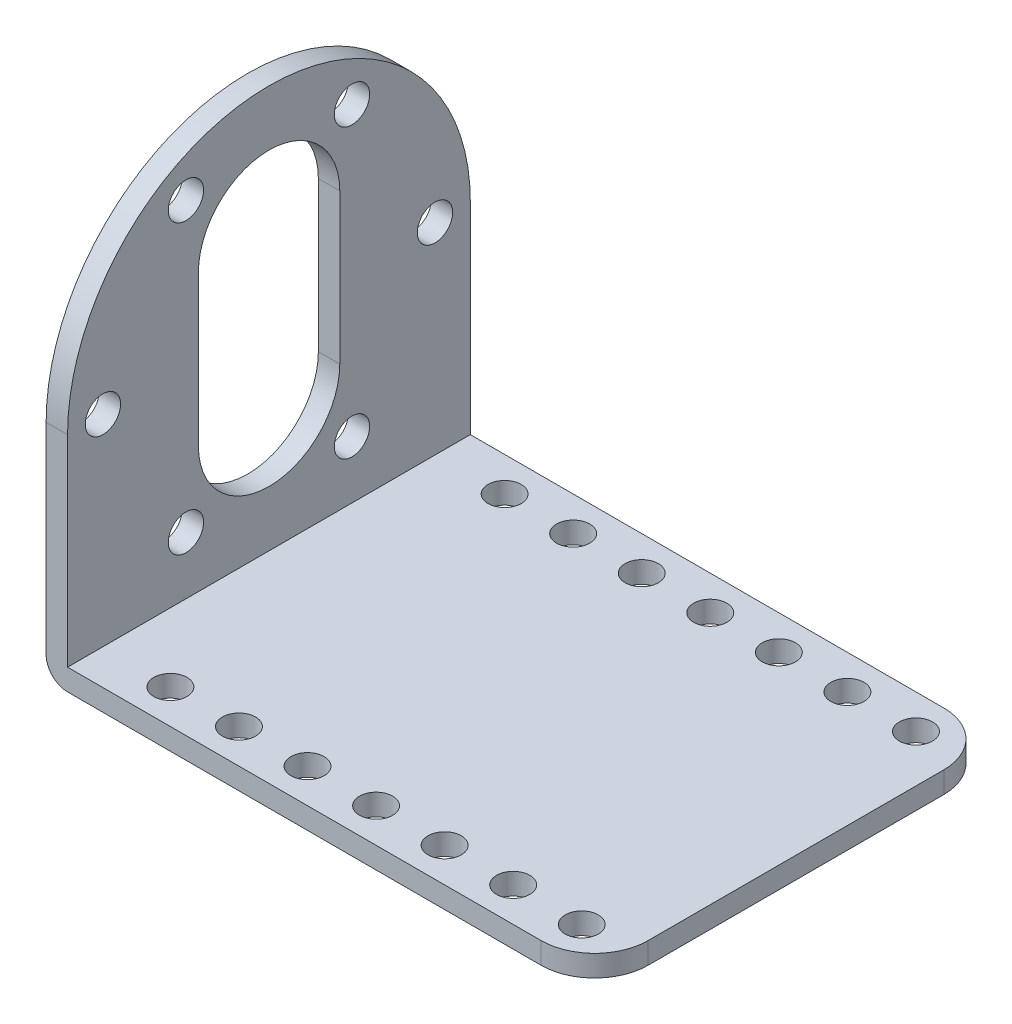
from build123d import *

# Parameters (mm, degrees)
SKETCH1_W           = 49.2
SKETCH1_H           = 37.6
BOSS_EXTRUDE1_DEPTH = 2
SKETCH2_W           = 2
SKETCH2_H           = 37.6
BOSS_EXTRUDE2_DEPTH = 37.6
BOSS_EXTRUDE5_DEPTH = 37.6
CUT_EXTRUDE1_REACH  = 78.051
SKETCH4_R           = 1.55
FILLET2_R           = 5
CUT_EXTRUDE2_REACH  = 70.887
SKETCH5_R           = 1.65
CUT_EXTRUDE3_START  = -2
CUT_EXTRUDE3_DEPTH  = 2
CUT_EXTRUDE4_REACH  = 70.887


# Read off the part's stored shape, not the designer's step: Cut-Extrude3
with BuildPart() as part:
    # Sketch1 → Boss-Extrude1 (new body)
    with BuildSketch(Plane(origin=(0, 0, 0), x_dir=(1, 0, 0), z_dir=(0, 1, 0))):
        with Locations((-33.511891694, -8.706295402)):
            Rectangle(SKETCH1_W, SKETCH1_H)
    extrude(amount=BOSS_EXTRUDE1_DEPTH)



with BuildPart() as body_2:
    # Sketch2 → Boss-Extrude2 (new body)
    with BuildSketch(Plane(origin=(0, 2, 0), x_dir=(1, 0, 0), z_dir=(0, 1, 0))):
        with Locations((-59.111891694, -8.706295402)):
            Rectangle(SKETCH2_W, SKETCH2_H)
    extrude(amount=BOSS_EXTRUDE2_DEPTH)


with BuildPart() as part_1:
    add(part.part)

    add(body_2.part)  # Boss-Extrude5 merges body 2
    # Sketch3 → Boss-Extrude5 (add)
    with BuildSketch(Plane.XY.offset(27.506295402)):
        with BuildLine():
            Line((-60.111891694, 2), (-58.111891694, 2))
            Line((-58.111891694, 2), (-58.111891694, 0))
            ThreePointArc((-58.111891694, 0), (-59.526105257, 0.585786438), (-60.111891694, 2))
        make_face()
    extrude(amount=-BOSS_EXTRUDE5_DEPTH)

    # Sketch4 → Cut-Extrude1 (cut, up to next)
    with BuildSketch(Plane(origin=(0, 2, 0), x_dir=(1, 0, 0), z_dir=(0, 1, 0)), mode=Mode.PRIVATE) as cut_extrude1_sk1:
        with Locations(Location((-51.711891694, 6.893704598, 0), (0, 0, 270))):
            Circle(SKETCH4_R)
    cut_extrude1_tool1 = extrude(cut_extrude1_sk1.sketch, amount=-CUT_EXTRUDE1_REACH, mode=Mode.PRIVATE) & part_1.part
    # Sketch4 → Cut-Extrude1 (cut, up to next)
    with BuildSketch(Plane(origin=(0, 2, 0), x_dir=(1, 0, 0), z_dir=(0, 1, 0)), mode=Mode.PRIVATE) as cut_extrude1_sk2:
        with Locations(Location((-51.711891694, -24.306295402, 0), (0, 0, 270))):
            Circle(SKETCH4_R)
    cut_extrude1_tool2 = extrude(cut_extrude1_sk2.sketch, amount=-CUT_EXTRUDE1_REACH, mode=Mode.PRIVATE) & part_1.part
    # Sketch4 → Cut-Extrude1 (cut, up to next)
    with BuildSketch(Plane(origin=(0, 2, 0), x_dir=(1, 0, 0), z_dir=(0, 1, 0)), mode=Mode.PRIVATE) as cut_extrude1_sk3:
        with Locations(Location((-45.311891694, 6.893704598, 0), (0, 0, 270))):
            Circle(SKETCH4_R)
    cut_extrude1_tool3 = extrude(cut_extrude1_sk3.sketch, amount=-CUT_EXTRUDE1_REACH, mode=Mode.PRIVATE) & part_1.part
    # Sketch4 → Cut-Extrude1 (cut, up to next)
    with BuildSketch(Plane(origin=(0, 2, 0), x_dir=(1, 0, 0), z_dir=(0, 1, 0)), mode=Mode.PRIVATE) as cut_extrude1_sk4:
        with Locations(Location((-38.911891694, 6.893704598, 0), (0, 0, 270))):
            Circle(SKETCH4_R)
    cut_extrude1_tool4 = extrude(cut_extrude1_sk4.sketch, amount=-CUT_EXTRUDE1_REACH, mode=Mode.PRIVATE) & part_1.part
    # Sketch4 → Cut-Extrude1 (cut, up to next)
    with BuildSketch(Plane(origin=(0, 2, 0), x_dir=(1, 0, 0), z_dir=(0, 1, 0)), mode=Mode.PRIVATE) as cut_extrude1_sk5:
        with Locations(Location((-32.511891694, 6.893704598, 0), (0, 0, 270))):
            Circle(SKETCH4_R)
    cut_extrude1_tool5 = extrude(cut_extrude1_sk5.sketch, amount=-CUT_EXTRUDE1_REACH, mode=Mode.PRIVATE) & part_1.part
    # Sketch4 → Cut-Extrude1 (cut, up to next)
    with BuildSketch(Plane(origin=(0, 2, 0), x_dir=(1, 0, 0), z_dir=(0, 1, 0)), mode=Mode.PRIVATE) as cut_extrude1_sk6:
        with Locations(Location((-26.111891694, 6.893704598, 0), (0, 0, 270))):
            Circle(SKETCH4_R)
    cut_extrude1_tool6 = extrude(cut_extrude1_sk6.sketch, amount=-CUT_EXTRUDE1_REACH, mode=Mode.PRIVATE) & part_1.part
    # Sketch4 → Cut-Extrude1 (cut, up to next)
    with BuildSketch(Plane(origin=(0, 2, 0), x_dir=(1, 0, 0), z_dir=(0, 1, 0)), mode=Mode.PRIVATE) as cut_extrude1_sk7:
        with Locations(Location((-19.711891694, 6.893704598, 0), (0, 0, 270))):
            Circle(SKETCH4_R)
    cut_extrude1_tool7 = extrude(cut_extrude1_sk7.sketch, amount=-CUT_EXTRUDE1_REACH, mode=Mode.PRIVATE) & part_1.part
    # Sketch4 → Cut-Extrude1 (cut, up to next)
    with BuildSketch(Plane(origin=(0, 2, 0), x_dir=(1, 0, 0), z_dir=(0, 1, 0)), mode=Mode.PRIVATE) as cut_extrude1_sk8:
        with Locations(Location((-13.311891694, 6.893704598, 0), (0, 0, 270))):
            Circle(SKETCH4_R)
    cut_extrude1_tool8 = extrude(cut_extrude1_sk8.sketch, amount=-CUT_EXTRUDE1_REACH, mode=Mode.PRIVATE) & part_1.part
    # Sketch4 → Cut-Extrude1 (cut, up to next)
    with BuildSketch(Plane(origin=(0, 2, 0), x_dir=(1, 0, 0), z_dir=(0, 1, 0)), mode=Mode.PRIVATE) as cut_extrude1_sk9:
        with Locations(Location((-13.311891694, -24.306295402, 0), (0, 0, 270))):
            Circle(SKETCH4_R)
    cut_extrude1_tool9 = extrude(cut_extrude1_sk9.sketch, amount=-CUT_EXTRUDE1_REACH, mode=Mode.PRIVATE) & part_1.part
    # Sketch4 → Cut-Extrude1 (cut, up to next)
    with BuildSketch(Plane(origin=(0, 2, 0), x_dir=(1, 0, 0), z_dir=(0, 1, 0)), mode=Mode.PRIVATE) as cut_extrude1_sk10:
        with Locations(Location((-19.711891694, -24.306295402, 0), (0, 0, 270))):
            Circle(SKETCH4_R)
    cut_extrude1_tool10 = extrude(cut_extrude1_sk10.sketch, amount=-CUT_EXTRUDE1_REACH, mode=Mode.PRIVATE) & part_1.part
    # Sketch4 → Cut-Extrude1 (cut, up to next)
    with BuildSketch(Plane(origin=(0, 2, 0), x_dir=(1, 0, 0), z_dir=(0, 1, 0)), mode=Mode.PRIVATE) as cut_extrude1_sk11:
        with Locations(Location((-26.111891694, -24.306295402, 0), (0, 0, 270))):
            Circle(SKETCH4_R)
    cut_extrude1_tool11 = extrude(cut_extrude1_sk11.sketch, amount=-CUT_EXTRUDE1_REACH, mode=Mode.PRIVATE) & part_1.part
    # Sketch4 → Cut-Extrude1 (cut, up to next)
    with BuildSketch(Plane(origin=(0, 2, 0), x_dir=(1, 0, 0), z_dir=(0, 1, 0)), mode=Mode.PRIVATE) as cut_extrude1_sk12:
        with Locations(Location((-32.511891694, -24.306295402, 0), (0, 0, 270))):
            Circle(SKETCH4_R)
    cut_extrude1_tool12 = extrude(cut_extrude1_sk12.sketch, amount=-CUT_EXTRUDE1_REACH, mode=Mode.PRIVATE) & part_1.part
    # Sketch4 → Cut-Extrude1 (cut, up to next)
    with BuildSketch(Plane(origin=(0, 2, 0), x_dir=(1, 0, 0), z_dir=(0, 1, 0)), mode=Mode.PRIVATE) as cut_extrude1_sk13:
        with Locations(Location((-38.911891694, -24.306295402, 0), (0, 0, 270))):
            Circle(SKETCH4_R)
    cut_extrude1_tool13 = extrude(cut_extrude1_sk13.sketch, amount=-CUT_EXTRUDE1_REACH, mode=Mode.PRIVATE) & part_1.part
    # Sketch4 → Cut-Extrude1 (cut, up to next)
    with BuildSketch(Plane(origin=(0, 2, 0), x_dir=(1, 0, 0), z_dir=(0, 1, 0)), mode=Mode.PRIVATE) as cut_extrude1_sk14:
        with Locations(Location((-45.311891694, -24.306295402, 0), (0, 0, 270))):
            Circle(SKETCH4_R)
    cut_extrude1_tool14 = extrude(cut_extrude1_sk14.sketch, amount=-CUT_EXTRUDE1_REACH, mode=Mode.PRIVATE) & part_1.part
    add(cut_extrude1_tool1.solids().sort_by_distance((-51.711892, 2, -6.893705))[0], mode=Mode.SUBTRACT)
    add(cut_extrude1_tool2.solids().sort_by_distance((-51.711892, 2, 24.306295))[0], mode=Mode.SUBTRACT)
    add(cut_extrude1_tool3.solids().sort_by_distance((-45.311892, 2, -6.893705))[0], mode=Mode.SUBTRACT)
    add(cut_extrude1_tool4.solids().sort_by_distance((-38.911892, 2, -6.893705))[0], mode=Mode.SUBTRACT)
    add(cut_extrude1_tool5.solids().sort_by_distance((-32.511892, 2, -6.893705))[0], mode=Mode.SUBTRACT)
    add(cut_extrude1_tool6.solids().sort_by_distance((-26.111892, 2, -6.893705))[0], mode=Mode.SUBTRACT)
    add(cut_extrude1_tool7.solids().sort_by_distance((-19.711892, 2, -6.893705))[0], mode=Mode.SUBTRACT)
    add(cut_extrude1_tool8.solids().sort_by_distance((-13.311892, 2, -6.893705))[0], mode=Mode.SUBTRACT)
    add(cut_extrude1_tool9.solids().sort_by_distance((-13.311892, 2, 24.306295))[0], mode=Mode.SUBTRACT)
    add(cut_extrude1_tool10.solids().sort_by_distance((-19.711892, 2, 24.306295))[0], mode=Mode.SUBTRACT)
    add(cut_extrude1_tool11.solids().sort_by_distance((-26.111892, 2, 24.306295))[0], mode=Mode.SUBTRACT)
    add(cut_extrude1_tool12.solids().sort_by_distance((-32.511892, 2, 24.306295))[0], mode=Mode.SUBTRACT)
    add(cut_extrude1_tool13.solids().sort_by_distance((-38.911892, 2, 24.306295))[0], mode=Mode.SUBTRACT)
    add(cut_extrude1_tool14.solids().sort_by_distance((-45.311892, 2, 24.306295))[0], mode=Mode.SUBTRACT)

    # Fillet2
    fillet2_edges = [part_1.edges().sort_by_distance(p)[0] for p in [
        (-8.911891694, 1, 27.506295402),
        (-8.911891694, 1, -10.093704598),
    ]]
    fillet(fillet2_edges, radius=FILLET2_R)

    # Sketch5 → Cut-Extrude2 (cut, up to next)
    with BuildSketch(Plane(origin=(-58.111891694, 0, 0), x_dir=(0, 0, -1), z_dir=(1, 0, 0)), mode=Mode.PRIVATE) as cut_extrude2_sk1:
        with Locations((6.793704598, 20.8)):
            Circle(SKETCH5_R)
    cut_extrude2_tool1 = extrude(cut_extrude2_sk1.sketch, amount=-CUT_EXTRUDE2_REACH, mode=Mode.PRIVATE) & part_1.part
    # Sketch5 → Cut-Extrude2 (cut, up to next)
    with BuildSketch(Plane(origin=(-58.111891694, 0, 0), x_dir=(0, 0, -1), z_dir=(1, 0, 0)), mode=Mode.PRIVATE) as cut_extrude2_sk2:
        with Locations((-0.956295402, 7.376606241)):
            Circle(SKETCH5_R)
    cut_extrude2_tool2 = extrude(cut_extrude2_sk2.sketch, amount=-CUT_EXTRUDE2_REACH, mode=Mode.PRIVATE) & part_1.part
    # Sketch5 → Cut-Extrude2 (cut, up to next)
    with BuildSketch(Plane(origin=(-58.111891694, 0, 0), x_dir=(0, 0, -1), z_dir=(1, 0, 0)), mode=Mode.PRIVATE) as cut_extrude2_sk3:
        with Locations((-16.456295402, 7.376606241)):
            Circle(SKETCH5_R)
    cut_extrude2_tool3 = extrude(cut_extrude2_sk3.sketch, amount=-CUT_EXTRUDE2_REACH, mode=Mode.PRIVATE) & part_1.part
    # Sketch5 → Cut-Extrude2 (cut, up to next)
    with BuildSketch(Plane(origin=(-58.111891694, 0, 0), x_dir=(0, 0, -1), z_dir=(1, 0, 0)), mode=Mode.PRIVATE) as cut_extrude2_sk4:
        with Locations((-24.206295402, 20.8)):
            Circle(SKETCH5_R)
    cut_extrude2_tool4 = extrude(cut_extrude2_sk4.sketch, amount=-CUT_EXTRUDE2_REACH, mode=Mode.PRIVATE) & part_1.part
    # Sketch5 → Cut-Extrude2 (cut, up to next)
    with BuildSketch(Plane(origin=(-58.111891694, 0, 0), x_dir=(0, 0, -1), z_dir=(1, 0, 0)), mode=Mode.PRIVATE) as cut_extrude2_sk5:
        with Locations((-16.456295402, 34.223393759)):
            Circle(SKETCH5_R)
    cut_extrude2_tool5 = extrude(cut_extrude2_sk5.sketch, amount=-CUT_EXTRUDE2_REACH, mode=Mode.PRIVATE) & part_1.part
    # Sketch5 → Cut-Extrude2 (cut, up to next)
    with BuildSketch(Plane(origin=(-58.111891694, 0, 0), x_dir=(0, 0, -1), z_dir=(1, 0, 0)), mode=Mode.PRIVATE) as cut_extrude2_sk6:
        with Locations((-0.956295402, 34.223393759)):
            Circle(SKETCH5_R)
    cut_extrude2_tool6 = extrude(cut_extrude2_sk6.sketch, amount=-CUT_EXTRUDE2_REACH, mode=Mode.PRIVATE) & part_1.part
    add(cut_extrude2_tool1.solids().sort_by_distance((-58.111892, 20.8, -6.793705))[0], mode=Mode.SUBTRACT)
    add(cut_extrude2_tool2.solids().sort_by_distance((-58.111892, 7.376606, 0.956295))[0], mode=Mode.SUBTRACT)
    add(cut_extrude2_tool3.solids().sort_by_distance((-58.111892, 7.376606, 16.456295))[0], mode=Mode.SUBTRACT)
    add(cut_extrude2_tool4.solids().sort_by_distance((-58.111892, 20.8, 24.206295))[0], mode=Mode.SUBTRACT)
    add(cut_extrude2_tool5.solids().sort_by_distance((-58.111892, 34.223394, 16.456295))[0], mode=Mode.SUBTRACT)
    add(cut_extrude2_tool6.solids().sort_by_distance((-58.111892, 34.223394, 0.956295))[0], mode=Mode.SUBTRACT)

    # Cut-Extrude3 outline → Cut-Extrude3 (cut)
    with BuildSketch(Plane(origin=(-58.111891694, 0, 0), x_dir=(0, 0, -1), z_dir=(1, 0, 0)).offset(CUT_EXTRUDE3_START)):
        with BuildLine():
            Line((-27.506295402, 39.6), (-27.506295402, 20.8))
            ThreePointArc((-27.506295402, 20.8), (-21.999902888, 34.093607486), (-8.706295402, 39.6))
            Line((-8.706295402, 39.6), (-27.506295402, 39.6))
        make_face()
        with BuildLine():
            Line((10.093704598, 39.6), (-8.706295402, 39.6))
            ThreePointArc((-8.706295402, 39.6), (4.587312084, 34.093607486), (10.093704598, 20.8))
            Line((10.093704598, 20.8), (10.093704598, 39.6))
        make_face()
    extrude(amount=CUT_EXTRUDE3_DEPTH, mode=Mode.SUBTRACT)

    # Sketch8 → Cut-Extrude4 (cut, up to next)
    with BuildSketch(Plane(origin=(-58.111891694, 0, 0), x_dir=(0, 0, -1), z_dir=(1, 0, 0)), mode=Mode.PRIVATE) as cut_extrude4_sk1:
        with BuildLine():
            Line((-15.294989136, 13.7999966), (-15.294989136, 27.7999966))
            ThreePointArc((-15.294989136, 27.7999966), (-8.694989136, 34.3999966), (-2.094989136, 27.7999966))
            Line((-2.094989136, 27.7999966), (-2.094989136, 13.7999966))
            ThreePointArc((-2.094989136, 13.7999966), (-8.694989136, 7.1999966), (-15.294989136, 13.7999966))
        make_face()
    cut_extrude4_tool1 = extrude(cut_extrude4_sk1.sketch, amount=-CUT_EXTRUDE4_REACH, mode=Mode.PRIVATE) & part_1.part
    add(cut_extrude4_tool1.solids().sort_by_distance((-58.111892, 20.799997, 8.694989))[0], mode=Mode.SUBTRACT)


solid = part_1.part
